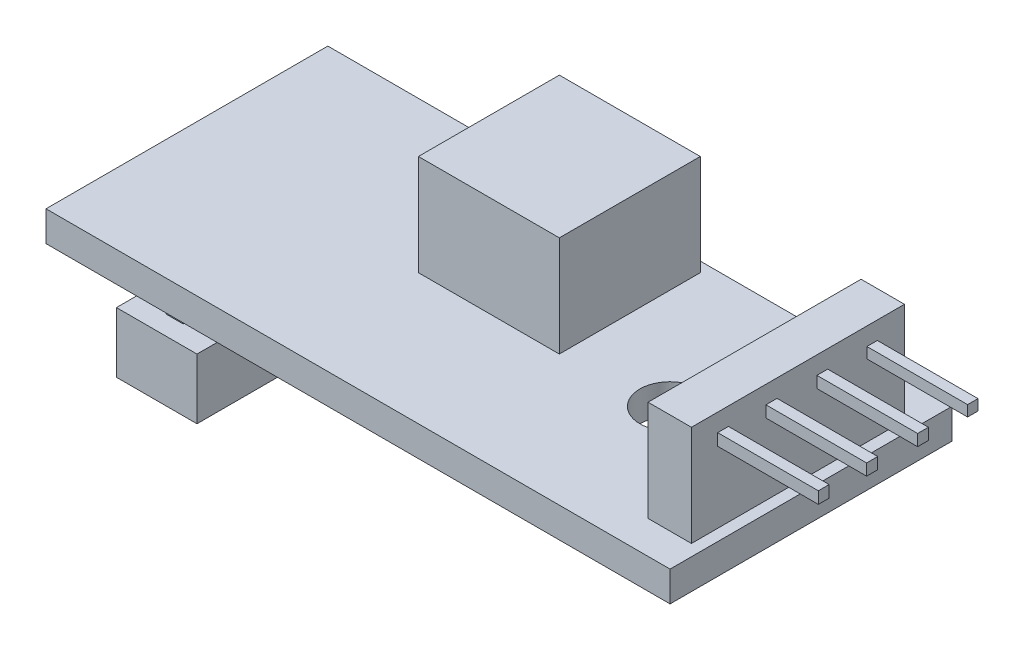
from build123d import *

# Parameters (mm, degrees)
SKETCH_1_W          = 31
SKETCH_1_H          = 14
EXTRUDE_1_DEPTH     = 1.5
SKETCH_2_W          = 7
SKETCH_2_H          = 7
EXTRUDE_2_DEPTH     = 5
SKETCH_3_W          = 2.154803144
SKETCH_3_H          = 10.581622582
EXTRUDE_3_DEPTH     = 5
SKETCH_5_W          = 0.534399799
SKETCH_5_H          = 0.586115909
EXTRUDE_4_DEPTH     = 5
SKETCH_5_W_2        = 0.551638502
SKETCH_5_H_2        = 0.568877205
EXTRUDE_4_2_DEPTH   = 5
EXTRUDE_4_3_DEPTH   = 5
SKETCH_5_W_3        = 0.517161096
SKETCH_5_H_3        = 0.534399799
EXTRUDE_4_4_DEPTH   = 5
EXTRUDE_START       = 3
SKETCH_6_W          = 4
SKETCH_6_H          = 10
EXTRUDE_5_DEPTH     = 3
EXTRUDE_6_REACH     = 38.695
SKETCH_7_W          = 0.842892203
SKETCH_7_H          = 0.696302255
SKETCH_7_H_2        = 0.659654768
SKETCH_7_H_3        = 0.732949742
SKETCH_8_R          = 1.5
CUT_EXTRUDE_1_DEPTH = 3


with BuildPart() as part:
    # 草圖1 → 填料-伸長1 (new body)
    with BuildSketch(Plane(origin=(0, 0, 0), x_dir=(1, 0, 0), z_dir=(0, 1, 0))):
        with Locations((15.5, 0)):
            Rectangle(SKETCH_1_W, SKETCH_1_H)
    extrude(amount=EXTRUDE_1_DEPTH)

    # 草圖8 → 除料-伸長1 (cut)
    with BuildSketch(Plane(origin=(0, 1.5, 0), x_dir=(1, 0, 0), z_dir=(0, 1, 0))):
        with Locations((24, 0)):
            Circle(SKETCH_8_R)
    extrude(amount=-CUT_EXTRUDE_1_DEPTH, mode=Mode.SUBTRACT)


with BuildPart() as body_2:
    # 草圖2 → 填料-伸長2 (new body)
    with BuildSketch(Plane(origin=(0, 1.5, 0), x_dir=(1, 0, 0), z_dir=(0, 1, 0))):
        with Locations((15.5, 3)):
            Rectangle(SKETCH_2_W, SKETCH_2_H)
    extrude(amount=EXTRUDE_2_DEPTH)


with BuildPart() as body_3:
    # 草圖3 → 填料-伸長3 (new body)
    with BuildSketch(Plane(origin=(0, 1.5, 0), x_dir=(1, 0, 0), z_dir=(0, 1, 0))):
        with Locations((29.352305926, -0.076957255)):
            Rectangle(SKETCH_3_W, SKETCH_3_H)
    extrude(amount=EXTRUDE_3_DEPTH)


with BuildPart() as body_4:
    # 草圖5 → 填料-伸長4 (new body)
    with BuildSketch(Plane(origin=(30.429707498, 0, 0), x_dir=(0, 0, -1), z_dir=(1, 0, 0))):
        with Locations((-3.795796662, 5.3218671)):
            Rectangle(SKETCH_5_W, SKETCH_5_H)
    extrude(amount=EXTRUDE_4_DEPTH)


with BuildPart() as body_5:
    # 草圖5 → Extrude 4 2 (new body)
    with BuildSketch(Plane(origin=(30.429707498, 0, 0), x_dir=(0, 0, -1), z_dir=(1, 0, 0))):
        with Locations((-1.390997567, 5.330486452)):
            Rectangle(SKETCH_5_W_2, SKETCH_5_H_2)
    extrude(amount=EXTRUDE_4_2_DEPTH)


with BuildPart() as body_6:
    # 草圖5 → Extrude 4 3 (new body)
    with BuildSketch(Plane(origin=(30.429707498, 0, 0), x_dir=(0, 0, -1), z_dir=(1, 0, 0))):
        with Locations((1.134472451, 5.330486452)):
            Rectangle(SKETCH_5_W, SKETCH_5_H_2)
    extrude(amount=EXTRUDE_4_3_DEPTH)


with BuildPart() as body_7:
    # 草圖5 → Extrude 4 4 (new body)
    with BuildSketch(Plane(origin=(30.429707498, 0, 0), x_dir=(0, 0, -1), z_dir=(1, 0, 0))):
        with Locations((3.608226359, 5.347725155)):
            Rectangle(SKETCH_5_W_3, SKETCH_5_H_3)
    extrude(amount=EXTRUDE_4_4_DEPTH)


with BuildPart() as body_8:
    # 草圖6 → 填料-伸長5 (new body)
    with BuildSketch(Plane.XZ.offset(EXTRUDE_START)):
        with Locations((3.5, 0)):
            Rectangle(SKETCH_6_W, SKETCH_6_H)
    extrude(amount=EXTRUDE_5_DEPTH)


with BuildPart() as body_9:

    # 草圖7 → 填料-伸長6 (new, up to next)
    with BuildSketch(Plane.XZ, mode=Mode.PRIVATE) as extrude_6_sk1:
        with Locations((3.440657527, 3.701396197)):
            Rectangle(SKETCH_7_W, SKETCH_7_H)
    extrude_6_tool1 = extrude(extrude_6_sk1.sketch, amount=EXTRUDE_6_REACH, mode=Mode.PRIVATE) - body_8.part
    # 草圖7 → 填料-伸長6 (new, up to next)
    with BuildSketch(Plane.XZ, mode=Mode.PRIVATE) as extrude_6_sk2:
        with Locations((3.440657527, 1.300985792)):
            Rectangle(SKETCH_7_W, SKETCH_7_H_2)
    extrude_6_tool2 = extrude(extrude_6_sk2.sketch, amount=EXTRUDE_6_REACH, mode=Mode.PRIVATE) - body_8.part
    # 草圖7 → 填料-伸長6 (new, up to next)
    with BuildSketch(Plane.XZ, mode=Mode.PRIVATE) as extrude_6_sk3:
        with Locations((3.440657527, -1.374280766)):
            Rectangle(SKETCH_7_W, SKETCH_7_H_3)
    extrude_6_tool3 = extrude(extrude_6_sk3.sketch, amount=EXTRUDE_6_REACH, mode=Mode.PRIVATE) - body_8.part
    # 草圖7 → 填料-伸長6 (new, up to next)
    with BuildSketch(Plane.XZ, mode=Mode.PRIVATE) as extrude_6_sk4:
        with Locations((3.440657527, -3.756367427)):
            Rectangle(SKETCH_7_W, SKETCH_7_H_3)
    extrude_6_tool4 = extrude(extrude_6_sk4.sketch, amount=EXTRUDE_6_REACH, mode=Mode.PRIVATE) - body_8.part
    add(extrude_6_tool1.solids().sort_by_distance((3.440658, 0, 3.701396))[0])
    add(extrude_6_tool2.solids().sort_by_distance((3.440658, 0, 1.300986))[0])
    add(extrude_6_tool3.solids().sort_by_distance((3.440658, 0, -1.374281))[0])
    add(extrude_6_tool4.solids().sort_by_distance((3.440658, 0, -3.756367))[0])


solid = Compound([part.part, body_2.part, body_3.part, body_4.part, body_5.part, body_6.part, body_7.part, body_8.part, body_9.part])
